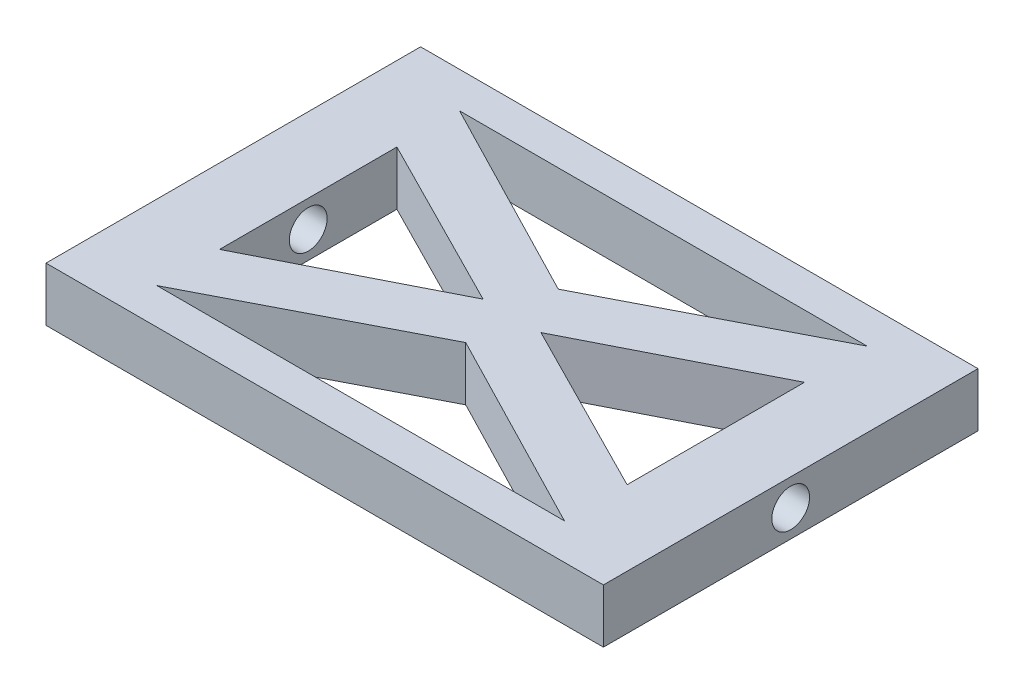
from build123d import *

# Parameters (mm, degrees)
SKETCH1_W           = 47.244
SKETCH1_H           = 31.75
BOSS_EXTRUDE1_DEPTH = 4.572
SKETCH4_R           = 1.6002
CUT_EXTRUDE3_DEPTH  = 7.62
CUT_EXTRUDE4_START  = -7.62
SKETCH5_R           = 1.6002
CUT_EXTRUDE4_DEPTH  = 7.62
CUT_EXTRUDE6_DEPTH  = 29.825642976


with BuildPart() as part:
    # Sketch1 → Boss-Extrude1 (new body)
    with BuildSketch(Plane(origin=(0, 0, 0), x_dir=(1, 0, 0), z_dir=(0, 1, 0))):
        Rectangle(SKETCH1_W, SKETCH1_H)
    extrude(amount=BOSS_EXTRUDE1_DEPTH)

    # Sketch4 → Cut-Extrude3 (cut)
    with BuildSketch(Plane(origin=(23.622, 0, 0), x_dir=(0, 0, -1), z_dir=(1, 0, 0))):
        with Locations((0, 2.286)):
            Circle(SKETCH4_R)
    extrude(amount=-CUT_EXTRUDE3_DEPTH, mode=Mode.SUBTRACT)

    # Sketch5 → Cut-Extrude4 (cut)
    with BuildSketch(Plane.ZY.offset(23.622).offset(CUT_EXTRUDE4_START)):
        with Locations((0, 2.286)):
            Circle(SKETCH5_R)
    extrude(amount=CUT_EXTRUDE4_DEPTH, mode=Mode.SUBTRACT)

    # Sketch6 → Cut-Extrude6 (cut, through all)
    with BuildSketch(Plane(origin=(0, 4.572, 0), x_dir=(1, 0, 0), z_dir=(0, 1, 0))):
        Polygon((17.272, 7.516807478), (2.452684226, 0), (17.272, -7.516807478), align=None)
        Polygon((17.272, -12.827), (0, -3.9213755), (-17.272, -12.827), align=None)
        Polygon((-17.272, -7.516807478), (-2.452684226, 0), (-17.272, 7.516807478), align=None)
        Polygon((0, 3.9213755), (17.272, 12.827), (-17.272, 12.827), align=None)
    extrude(amount=-CUT_EXTRUDE6_DEPTH, mode=Mode.SUBTRACT)


solid = part.part
